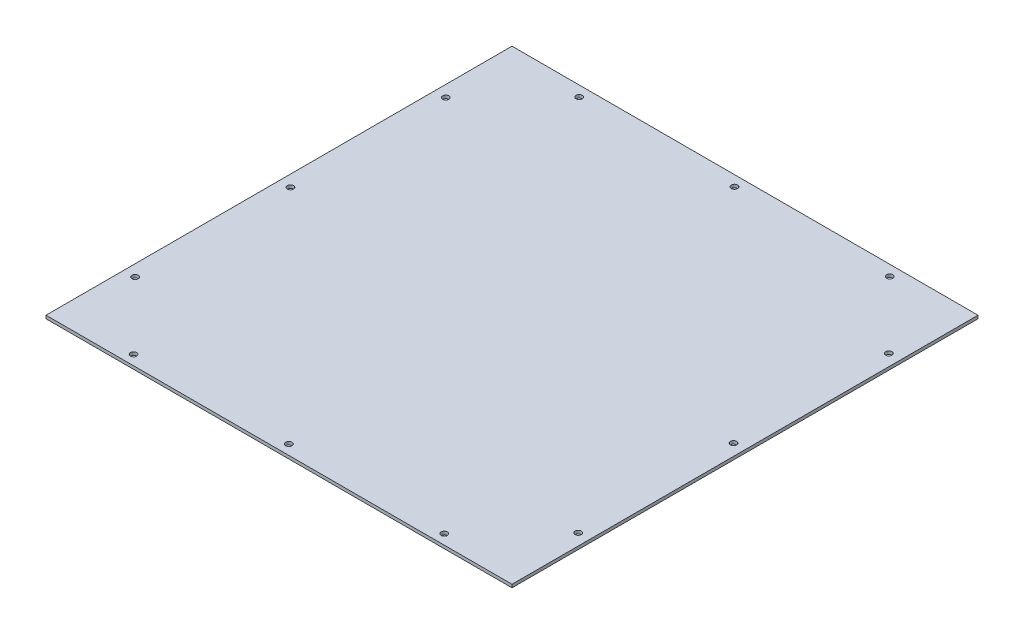
from build123d import *

# Parameters (mm, degrees)
SKETCH1_W           = 450
SKETCH1_H           = 450
BOSS_EXTRUDE1_DEPTH = 3
SKETCH6_R           = 3
CUT_EXTRUDE1_DEPTH  = 3


with BuildPart() as part:
    # Sketch1 → Boss-Extrude1 (new body)
    with BuildSketch(Plane(origin=(0, 0, 0), x_dir=(1, 0, 0), z_dir=(0, 1, 0))):
        Rectangle(SKETCH1_W, SKETCH1_H)
    extrude(amount=BOSS_EXTRUDE1_DEPTH)

    # Sketch6 → Cut-Extrude1 (cut)
    with BuildSketch(Plane(origin=(0, 3, 0), x_dir=(1, 0, 0), z_dir=(0, 1, 0))):
        with Locations(Location((-150, 214.83, 0), (0, 0, 270))):
            Circle(SKETCH6_R)
        with Locations(Location((0, 214.83, 0), (0, 0, 270))):
            Circle(SKETCH6_R)
        with Locations(Location((150, 214.83, 0), (0, 0, 270))):
            Circle(SKETCH6_R)
        with Locations(Location((150, -215.42, 0), (0, 0, 90))):
            Circle(SKETCH6_R)
        with Locations(Location((0, -215.420006429, 0), (0, 0, 90))):
            Circle(SKETCH6_R)
        with Locations(Location((-150, -215.420006429, 0), (0, 0, 90))):
            Circle(SKETCH6_R)
        with Locations(Location((213.95, 150, 0), (0, 0, 270))):
            Circle(SKETCH6_R)
        with Locations(Location((213.949999998, 0, 0), (0, 0, 270))):
            Circle(SKETCH6_R)
        with Locations(Location((213.949999998, -150, 0), (0, 0, 270))):
            Circle(SKETCH6_R)
        with Locations(Location((-213.949999802, -150, 0), (0, 0, 90))):
            Circle(SKETCH6_R)
        with Locations(Location((-213.949999604, 0, 0), (0, 0, 90))):
            Circle(SKETCH6_R)
        with Locations(Location((-213.95, 150, 0), (0, 0, 90))):
            Circle(SKETCH6_R)
    extrude(amount=-CUT_EXTRUDE1_DEPTH, mode=Mode.SUBTRACT)


solid = part.part
